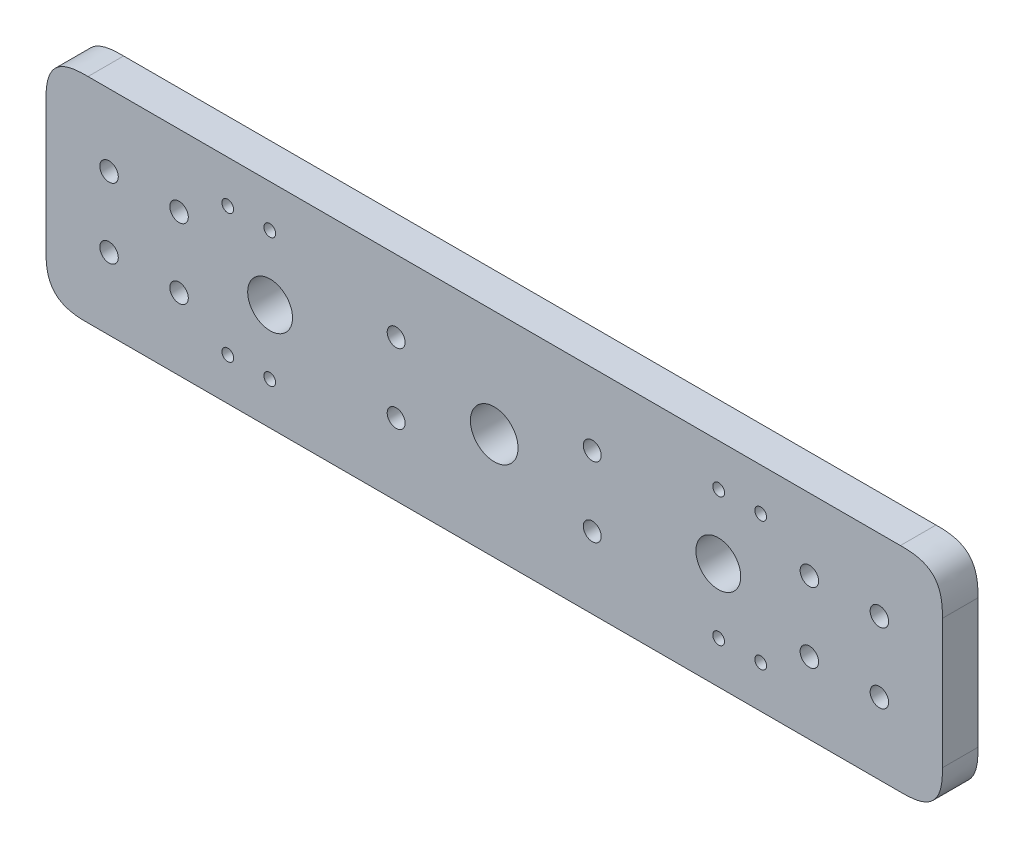
from build123d import *

# Parameters (mm, degrees)
SKETCH1_W                     = 320
SKETCH1_H                     = 76.2
BOSS_EXTRUDE1_DEPTH           = 12.7
M6_CLEARANCE_HOLE1_D          = 6.6
FILLET1_SIZE                  = 15
TAP_DRILL_FOR_M5X0_8_TAP1_D   = 4.2
SKETCH8_R                     = 8
CUT_EXTRUDE1_DEPTH            = 165.963329386
M6_CLEARANCE_HOLE2_D          = 6.4
M16_CLEARANCE_HOLE1_OUTLINE_R = 8.5
M16_CLEARANCE_HOLE1_DEPTH     = 12.7


with BuildPart() as part:
    # Sketch1 → Boss-Extrude1 (new body)
    with BuildSketch(Plane.XY):
        Rectangle(SKETCH1_W, SKETCH1_H)
    extrude(amount=BOSS_EXTRUDE1_DEPTH)

    # M6 Clearance Hole1 (through all)
    with Locations(Plane(origin=(0, 0, 0), x_dir=(-1, 0, 0), z_dir=(0, 0, -1))):
        with Locations((137.5, -12.5), (112.5, -12.5), (112.5, 12.5), (137.5, 12.5), (-112.5, -12.5), (-137.5, -12.5), (-112.5, 12.5), (-137.5, 12.5)):
            Hole(M6_CLEARANCE_HOLE1_D / 2)

    # Fillet1
    # a fillet whose section is not a circle: 15 mm, written as the material it takes off along each edge
    with BuildSketch(Plane(origin=(-160, 38.1, -37.5), x_dir=(1, 0, 0), z_dir=(0, 0, 1)), Plane(origin=(-160, -38.1, -37.5), x_dir=(0, 1, 0), z_dir=(0, 0, 1))) as fillet1_piece_1:
        with BuildLine():
            add(Edge.make_bspline([(FILLET1_SIZE, 0), (FILLET1_SIZE * 0.831801948466, 0), (FILLET1_SIZE * 0.663603896932, 0), (FILLET1_SIZE * 0.292893218813, -FILLET1_SIZE * 0.0716919198361), (FILLET1_SIZE * 0.0716919198361, -FILLET1_SIZE * 0.292893218813), (0, -FILLET1_SIZE * 0.663603896932), (0, -FILLET1_SIZE * 0.831801948466), (0, -FILLET1_SIZE)], knots=[0, 0, 0, 0, 0, 0, 0.5, 0.5, 1, 1, 1, 1, 1, 1], degree=5))
            Line((0, -FILLET1_SIZE), (0, 0))
            Line((0, 0), (FILLET1_SIZE, 0))
        make_face()
    extrude(amount=87.7, mode=Mode.SUBTRACT)
    with BuildSketch(Plane(origin=(160, 38.1, -37.5), x_dir=(-1, 0, 0), z_dir=(0, 0, 1)), Plane(origin=(160, -38.1, -37.5), x_dir=(0, 1, 0), z_dir=(0, 0, 1))) as fillet1_piece_2:
        with BuildLine():
            add(Edge.make_bspline([(FILLET1_SIZE, 0), (FILLET1_SIZE * 0.831801948466, 0), (FILLET1_SIZE * 0.663603896932, 0), (FILLET1_SIZE * 0.292893218813, FILLET1_SIZE * 0.0716919198361), (FILLET1_SIZE * 0.0716919198361, FILLET1_SIZE * 0.292893218813), (0, FILLET1_SIZE * 0.663603896932), (0, FILLET1_SIZE * 0.831801948466), (0, FILLET1_SIZE)], knots=[0, 0, 0, 0, 0, 0, 0.5, 0.5, 1, 1, 1, 1, 1, 1], degree=5))
            Line((0, FILLET1_SIZE), (0, 0))
            Line((0, 0), (FILLET1_SIZE, 0))
        make_face()
    extrude(amount=87.7, mode=Mode.SUBTRACT)

    # Tap Drill for M5x0.8 Tap1 (through all)
    with Locations(Plane.XY.offset(12.7)):
        with Locations((-95.121488027, -23), (-80.121488027, -23), (-95.121488027, 23), (-80.121488027, 23), (80.121488027, -23), (95.121488027, -23), (95.121488027, 23), (80.121488027, 23)):
            Hole(TAP_DRILL_FOR_M5X0_8_TAP1_D / 2)

    # Sketch8 → Cut-Extrude1 (cut, through all)
    with BuildSketch(Plane.XY.offset(12.7)):
        with Locations((-80, 0)):
            Circle(SKETCH8_R)
        with Locations((80, 0)):
            Circle(SKETCH8_R)
    extrude(amount=-CUT_EXTRUDE1_DEPTH, mode=Mode.SUBTRACT)

    # M6 Clearance Hole2 (through all)
    with Locations(Plane.XY.offset(12.7)):
        with Locations((-35, -12.5), (-35, 12.5), (35, 12.5), (35, -12.5)):
            Hole(M6_CLEARANCE_HOLE2_D / 2)

    # M16 Clearance Hole1: read off the stored shape, not the designer's step
    # M16 Clearance Hole1 outline → M16 Clearance Hole1 (cut)
    with BuildSketch(Plane.XY):
        Circle(M16_CLEARANCE_HOLE1_OUTLINE_R)
    extrude(amount=M16_CLEARANCE_HOLE1_DEPTH, mode=Mode.SUBTRACT)


solid = part.part
